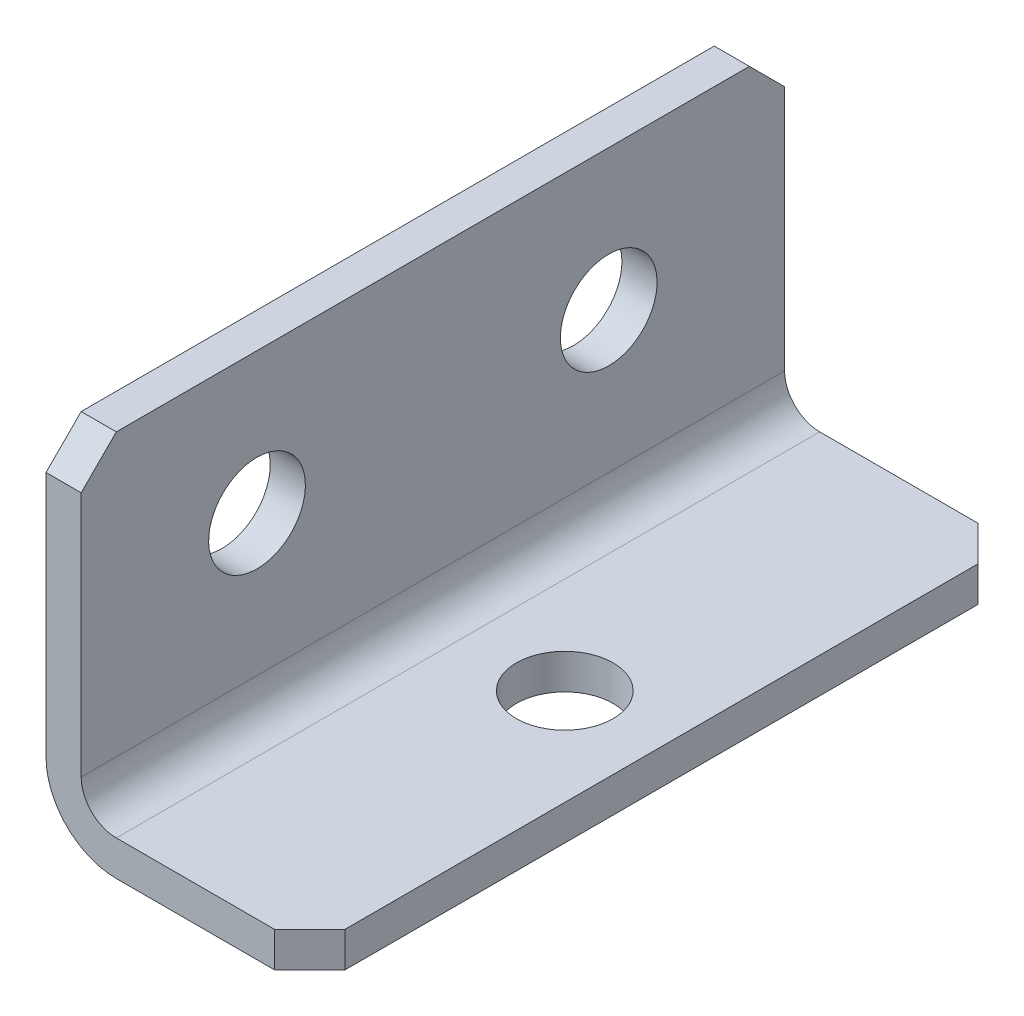
from build123d import *

# Parameters (mm, degrees)
BOSS_EXTRUDE1_DEPTH = 20
SKETCH2_R           = 2.75
CUT_EXTRUDE1_DEPTH  = 32.128764833
SKETCH3_R           = 2.75
CUT_EXTRUDE2_DEPTH  = 31.805843601
CHAMFER1_SIZE       = 2


with BuildPart() as part:
    # Sketch1 → Boss-Extrude1 (new, symmetric)
    with BuildSketch(Plane.XY):
        with BuildLine():
            Line((0, 4), (0, 20))
            Line((0, 20), (2, 20))
            Line((2, 20), (2, 4))
            ThreePointArc((2, 4), (2.585786438, 2.585786438), (4, 2))
            Line((4, 2), (15, 2))
            Line((15, 2), (15, 0))
            Line((15, 0), (4, 0))
            ThreePointArc((4, 0), (1.171572875, 1.171572875), (0, 4))
        make_face()
    extrude(amount=BOSS_EXTRUDE1_DEPTH, both=True)

    # Sketch2 → Cut-Extrude1 (cut, through all)
    with BuildSketch(Plane(origin=(2, 0, 0), x_dir=(0, 0, -1), z_dir=(1, 0, 0))):
        with Locations((-10, 12)):
            Circle(SKETCH2_R)
        with Locations((10, 12)):
            Circle(SKETCH2_R)
    extrude(amount=-CUT_EXTRUDE1_DEPTH, mode=Mode.SUBTRACT)

    # Sketch3 → Cut-Extrude2 (cut, through all)
    with BuildSketch(Plane(origin=(0, 2, 0), x_dir=(1, 0, 0), z_dir=(0, 1, 0))):
        with Locations((9.5, 0)):
            Circle(SKETCH3_R)
    extrude(amount=-CUT_EXTRUDE2_DEPTH, mode=Mode.SUBTRACT)

    # Chamfer1
    chamfer1_edges = [part.edges().sort_by_distance(p)[0] for p in [
        (1, 20, -20),
        (15, 1, -20),
        (15, 1, 20),
        (1, 20, 20),
    ]]
    chamfer(chamfer1_edges, length=CHAMFER1_SIZE)


solid = part.part
